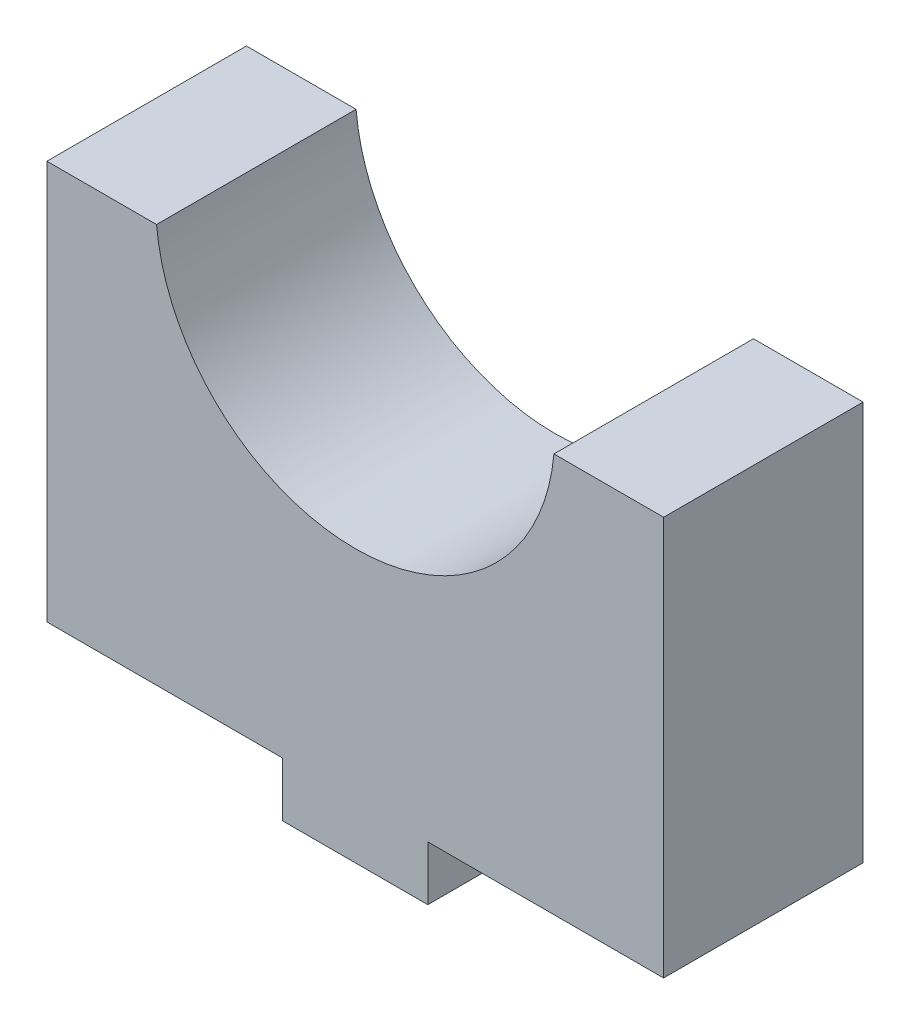
from build123d import *

# Parameters (mm, degrees)
BOSS_EXTRUDE1_DEPTH = 11
SKETCH2_W           = 8
SKETCH2_H           = 11
BOSS_EXTRUDE2_DEPTH = 3


with BuildPart() as part:
    # Sketch1 → Boss-Extrude1 (new body)
    with BuildSketch(Plane.XY):
        with BuildLine():
            Line((-10.95445115, -1), (-17, -1))
            Line((-17, -1), (-17, -23))
            Line((-17, -23), (17, -23))
            Line((17, -23), (17, -1))
            Line((17, -1), (10.95445115, -1))
            ThreePointArc((10.95445115, -1), (0, -11), (-10.95445115, -1))
        make_face()
    extrude(amount=BOSS_EXTRUDE1_DEPTH)

    # Sketch2 → Boss-Extrude2 (add)
    with BuildSketch(Plane.XZ.offset(23)):
        with Locations((0, 5.5)):
            Rectangle(SKETCH2_W, SKETCH2_H)
    extrude(amount=BOSS_EXTRUDE2_DEPTH)


solid = part.part
